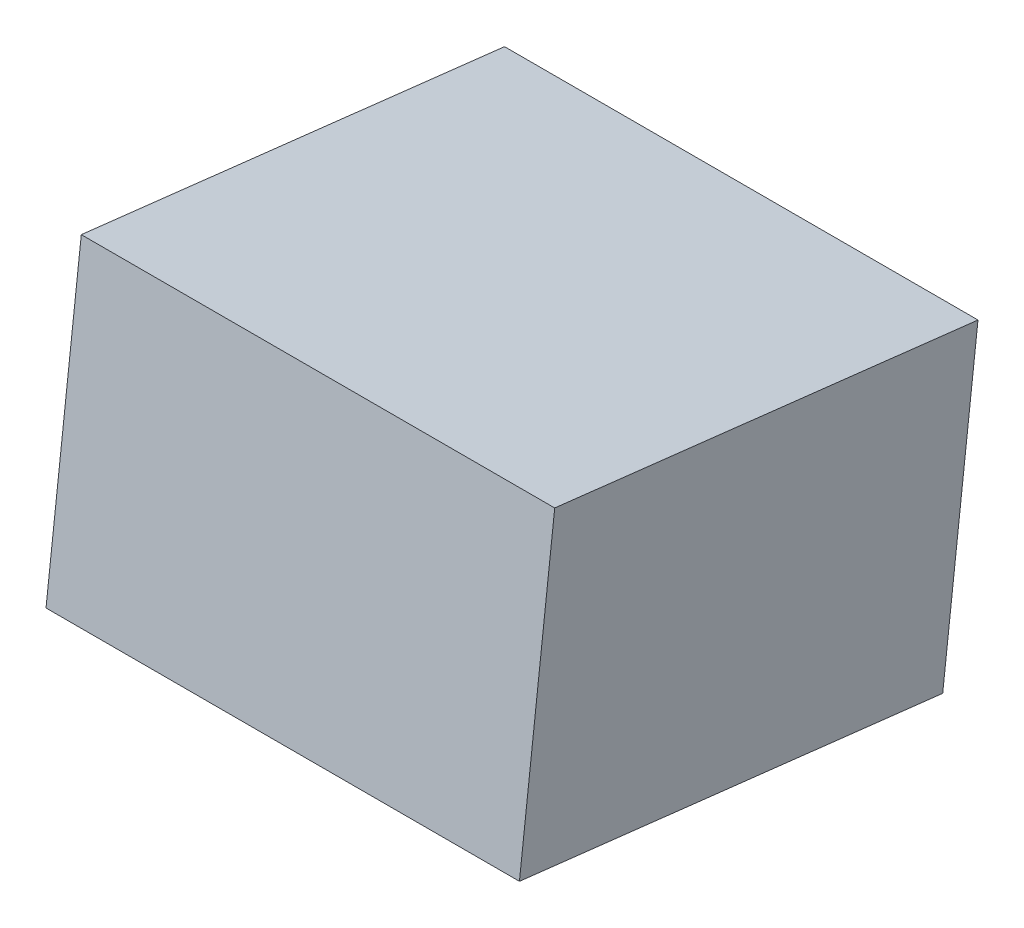
from build123d import *

# Parameters (mm, degrees)
SKETCH1_W           = 200
SKETCH1_H           = 180
BOSS_EXTRUDE1_DEPTH = 130


with BuildPart() as part:
    # Sketch1 → Boss-Extrude1 (new body)
    with BuildSketch(Plane(origin=(0, 358.879876801, -41.422455829), x_dir=(1, 0, 0), z_dir=(-6.837425950214788e-15, 0.9934047622419533, -0.1146602736566085))):
        with Locations((-131.67305734, 216.725409948)):
            Rectangle(SKETCH1_W, SKETCH1_H)
    extrude(amount=BOSS_EXTRUDE1_DEPTH)


solid = part.part
